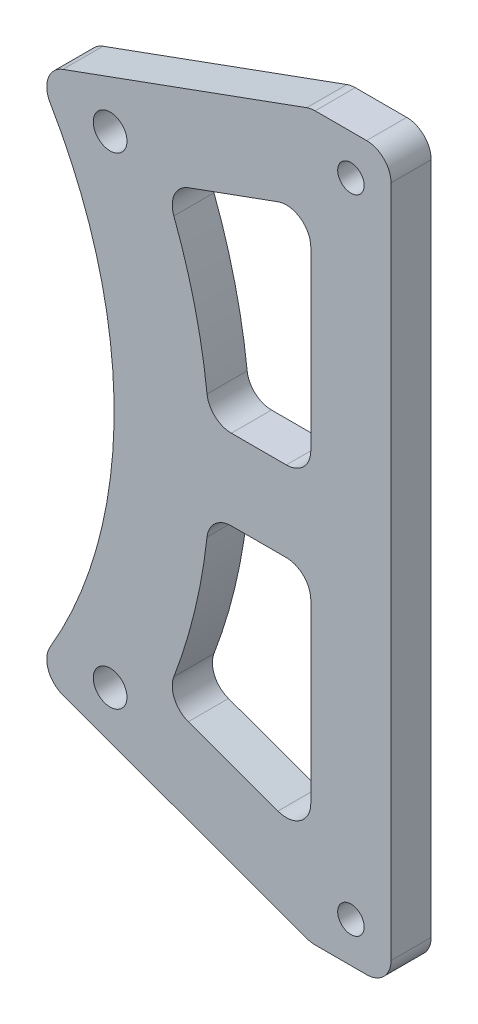
from build123d import *

# Parameters (mm, degrees)
SKETCH_1_R          = 2.1
SKETCH_1_R_2        = 1.65
EXTRUDE_1_DEPTH     = 5
CUT_EXTRUDE_1_DEPTH = 103.98664962
FILLET_1_R          = 3.05


with BuildPart() as part:
    # ｽｹｯﾁ1 → ﾎﾞｽ - 押し出し1 (new body)
    with BuildSketch(Plane.XY):
        with BuildLine():
            Line((92.5, -45), (92.5, 45))
            Line((92.5, 45), (82.5, 45))
            Line((82.5, 45), (48.062245684, 32.465682494))
            ThreePointArc((48.062245684, 32.465682494), (55.459941623, 16.976303342), (58, 0))
            ThreePointArc((58, 0), (55.459941623, -16.976303342), (48.062245684, -32.465682494))
            Line((48.062245684, -32.465682494), (82.5, -45))
            Line((82.5, -45), (92.5, -45))
        make_face()
        with Locations((57.5, -30)):
            Circle(SKETCH_1_R, mode=Mode.SUBTRACT)
        with Locations((87.5, -40)):
            Circle(SKETCH_1_R_2, mode=Mode.SUBTRACT)
        with Locations((57.5, 30)):
            Circle(SKETCH_1_R, mode=Mode.SUBTRACT)
        with Locations((87.5, 40)):
            Circle(SKETCH_1_R_2, mode=Mode.SUBTRACT)
    extrude(amount=EXTRUDE_1_DEPTH)

    # ｽｹｯﾁ2 → ｶｯﾄ - 押し出し1 (cut, through all)
    with BuildSketch(Plane.XY.offset(5)):
        with BuildLine():
            Line((69.821200219, 5), (82.5, 5))
            Line((82.5, 5), (82.5, 34.358222275))
            Line((82.5, 34.358222275), (64.275378191, 27.725002406))
            ThreePointArc((64.275378191, 27.725002406), (68.004261035, 16.595797092), (69.821200219, 5))
        make_face()
        with BuildLine():
            Line((82.5, -34.358222275), (82.5, -5))
            Line((82.5, -5), (69.821200219, -5))
            ThreePointArc((69.821200219, -5), (68.004261035, -16.595797092), (64.275378191, -27.725002406))
            Line((64.275378191, -27.725002406), (82.5, -34.358222275))
        make_face()
    extrude(amount=-CUT_EXTRUDE_1_DEPTH, mode=Mode.SUBTRACT)

    # ﾌｨﾚｯﾄ1
    fillet_1_edges = [part.edges().sort_by_distance(p)[0] for p in [
        (82.5, 45, 2.5),
        (48.062245684, 32.465682494, 2.5),
        (48.062245684, -32.465682494, 2.5),
        (82.5, -45, 2.5),
        (92.5, -45, 2.5),
        (92.5, 45, 2.5),
        (82.5, 5, 2.5),
        (82.5, 34.358222275, 2.5),
        (82.5, -5, 2.5),
        (82.5, -34.358222275, 2.5),
        (64.275378191, -27.725002406, 2.5),
        (69.821200219, -5, 2.5),
        (69.821200219, 5, 2.5),
        (64.275378191, 27.725002406, 2.5),
    ]]
    fillet(fillet_1_edges, radius=FILLET_1_R)


solid = part.part
